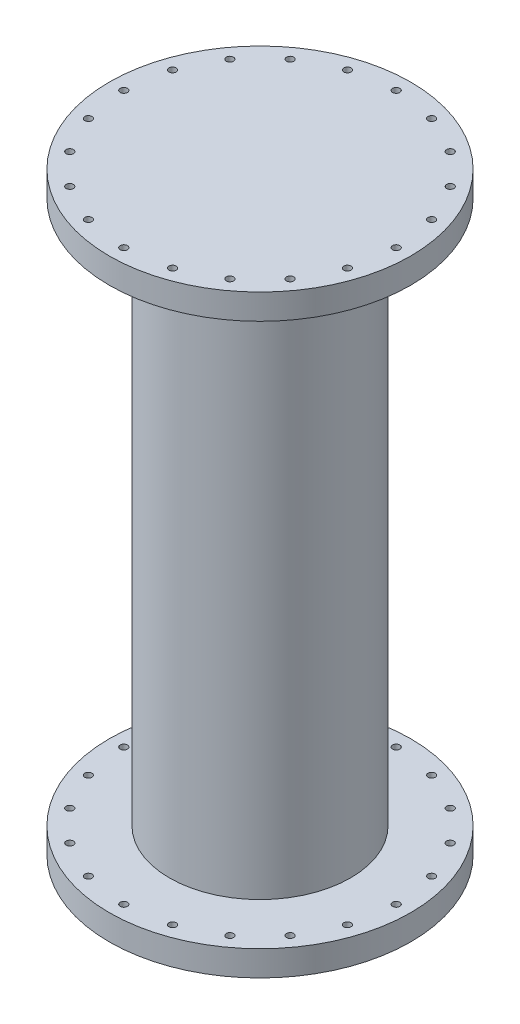
from build123d import *

# Parameters (mm, degrees)
ESQUISSE2_R                  = 10
ENL_V_MAT_EXTRU_1_DEPTH      = 1743.329475157
R_P_TITION_CIRCULAIRE1_COUNT = 20


with BuildPart() as part:
    # Esquisse1 → Révolution1 (revolve)
    with BuildSketch(Plane.XY):
        Polygon((0, 0), (416, 0), (416, -70), (250, -70), (250, -1570), (416, -1570), (416, -1640), (0, -1640), (0, -1570), (200, -1570), (200, -70), (0, -70), align=None)
    revolve(axis=Axis((0, 0, 0), (0, -1, 0)))

    # Esquisse2 → Enlèv. mat.-Extru.1 (cut, through all)
    with BuildSketch(Plane(origin=(0, 0, 0), x_dir=(1, 0, 0), z_dir=(0, 1, 0))):
        with Locations((376, 0)):
            Circle(ESQUISSE2_R)
    enl_v_mat_extru_1 = extrude(amount=-ENL_V_MAT_EXTRU_1_DEPTH, mode=Mode.SUBTRACT)

    # Répétition circulaire1: Enlèv. mat.-Extru.1 ×20 about axis
    r_p_tition_circulaire1_axis = Axis((0, 0, 0), (0, 1, 0))
    for i in range(1, R_P_TITION_CIRCULAIRE1_COUNT):
        add(enl_v_mat_extru_1.rotate(r_p_tition_circulaire1_axis, i * 360 / R_P_TITION_CIRCULAIRE1_COUNT), mode=Mode.SUBTRACT)


solid = part.part
